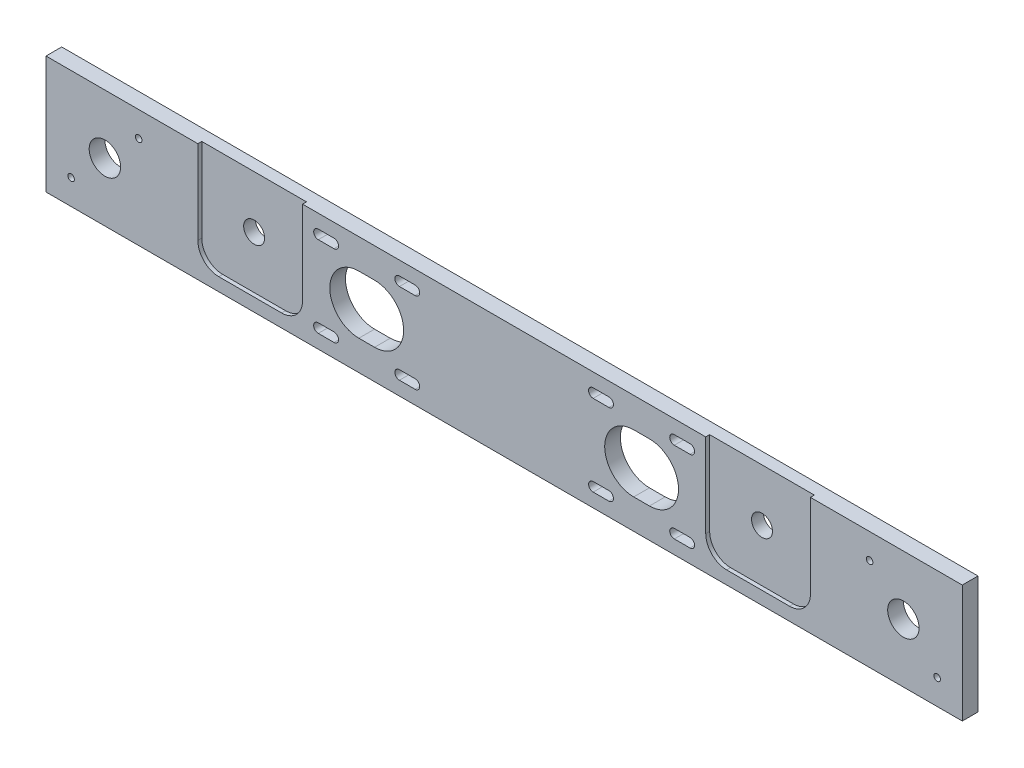
from build123d import *

# Parameters (mm, degrees)
CROQUIS1_W              = 350
CROQUIS1_H              = 45
SALIENTE_EXTRUIR1_DEPTH = 6
CROQUIS2_R              = 6
CROQUIS2_R_2            = 1.25
CORTAR_EXTRUIR1_DEPTH   = 353.932004783
CORTAR_EXTRUIR2_DEPTH   = 353.932004783
CORTAR_EXTRUIR4_DEPTH   = 1.5
CROQUIS7_R              = 4
CORTAR_EXTRUIR5_DEPTH   = 353.909690998


with BuildPart() as part:
    # Croquis1 → Saliente-Extruir1 (new body)
    with BuildSketch(Plane.XY):
        with Locations((-175, -22.5)):
            Rectangle(CROQUIS1_W, CROQUIS1_H)
    extrude(amount=SALIENTE_EXTRUIR1_DEPTH)

    # Croquis2 → Cortar-Extruir1 (cut, through all)
    with BuildSketch(Plane.XY.offset(6)):
        with Locations((-327.5, -22.5)):
            Circle(CROQUIS2_R)
        with Locations((-22.5, -22.5)):
            Circle(CROQUIS2_R)
        with Locations((-314.595301243, -9.595301243)):
            Circle(CROQUIS2_R_2)
        with Locations((-340.404698757, -35.404698757)):
            Circle(CROQUIS2_R_2)
        with Locations((-35.404698757, -9.595301243)):
            Circle(CROQUIS2_R_2)
        with Locations((-9.595301243, -35.404698757)):
            Circle(CROQUIS2_R_2)
    extrude(amount=-CORTAR_EXTRUIR1_DEPTH, mode=Mode.SUBTRACT)

    # Croquis3 → Cortar-Extruir2 (cut, through all)
    with BuildSketch(Plane.XY.offset(6)):
        with BuildLine():
            Line((-141, -5.25), (-135, -5.25))
            ThreePointArc((-135, -5.25), (-133.25, -7), (-135, -8.75))
            Line((-135, -8.75), (-141, -8.75))
            ThreePointArc((-141, -8.75), (-142.75, -7), (-141, -5.25))
        make_face()
        with BuildLine():
            Line((-125.5, -11.4), (-119.5, -11.4))
            ThreePointArc((-119.5, -11.4), (-108.4, -22.5), (-119.5, -33.6))
            Line((-119.5, -33.6), (-125.5, -33.6))
            ThreePointArc((-125.5, -33.6), (-136.6, -22.5), (-125.5, -11.4))
        make_face()
        with BuildLine():
            Line((-141, -36.25), (-135, -36.25))
            ThreePointArc((-135, -36.25), (-133.25, -38), (-135, -39.75))
            Line((-135, -39.75), (-141, -39.75))
            ThreePointArc((-141, -39.75), (-142.75, -38), (-141, -36.25))
        make_face()
        with BuildLine():
            Line((-110, -5.25), (-104, -5.25))
            ThreePointArc((-104, -5.25), (-102.25, -7), (-104, -8.75))
            Line((-104, -8.75), (-110, -8.75))
            ThreePointArc((-110, -8.75), (-111.75, -7), (-110, -5.25))
        make_face()
        with BuildLine():
            Line((-110, -36.25), (-104, -36.25))
            ThreePointArc((-104, -36.25), (-102.25, -38), (-104, -39.75))
            Line((-104, -39.75), (-110, -39.75))
            ThreePointArc((-110, -39.75), (-111.75, -38), (-110, -36.25))
        make_face()
        with BuildLine():
            Line((-246, -5.25), (-240, -5.25))
            ThreePointArc((-240, -5.25), (-238.25, -7), (-240, -8.75))
            Line((-240, -8.75), (-246, -8.75))
            ThreePointArc((-246, -8.75), (-247.75, -7), (-246, -5.25))
        make_face()
        with BuildLine():
            Line((-230.5, -11.4), (-224.5, -11.4))
            ThreePointArc((-224.5, -11.4), (-213.4, -22.5), (-224.5, -33.6))
            Line((-224.5, -33.6), (-230.5, -33.6))
            ThreePointArc((-230.5, -33.6), (-241.6, -22.5), (-230.5, -11.4))
        make_face()
        with BuildLine():
            Line((-246, -36.25), (-240, -36.25))
            ThreePointArc((-240, -36.25), (-238.25, -38), (-240, -39.75))
            Line((-240, -39.75), (-246, -39.75))
            ThreePointArc((-246, -39.75), (-247.75, -38), (-246, -36.25))
        make_face()
        with BuildLine():
            Line((-215, -5.25), (-209, -5.25))
            ThreePointArc((-209, -5.25), (-207.25, -7), (-209, -8.75))
            Line((-209, -8.75), (-215, -8.75))
            ThreePointArc((-215, -8.75), (-216.75, -7), (-215, -5.25))
        make_face()
        with BuildLine():
            Line((-215, -36.25), (-209, -36.25))
            ThreePointArc((-209, -36.25), (-207.25, -38), (-209, -39.75))
            Line((-209, -39.75), (-215, -39.75))
            ThreePointArc((-215, -39.75), (-216.75, -38), (-215, -36.25))
        make_face()
    extrude(amount=-CORTAR_EXTRUIR2_DEPTH, mode=Mode.SUBTRACT)

    # Croquis5 → Cortar-Extruir4 (cut)
    with BuildSketch(Plane.XY.offset(6)):
        with BuildLine():
            Line((-292, 0), (-252, 0))
            Line((-252, 0), (-252, -32))
            ThreePointArc((-252, -32), (-254.343145751, -37.656854249), (-260, -40))
            Line((-260, -40), (-284, -40))
            ThreePointArc((-284, -40), (-289.656854249, -37.656854249), (-292, -32))
            Line((-292, -32), (-292, 0))
        make_face()
        with BuildLine():
            Line((-98, 0), (-58, 0))
            Line((-58, 0), (-58, -32))
            ThreePointArc((-58, -32), (-60.343145751, -37.656854249), (-66, -40))
            Line((-66, -40), (-90, -40))
            ThreePointArc((-90, -40), (-95.656854249, -37.656854249), (-98, -32))
            Line((-98, -32), (-98, 0))
        make_face()
    extrude(amount=-CORTAR_EXTRUIR4_DEPTH, mode=Mode.SUBTRACT)

    # Croquis7 → Cortar-Extruir5 (cut, through all)
    with BuildSketch(Plane.XY.offset(4.5)):
        with Locations((-272, -20)):
            Circle(CROQUIS7_R)
        with Locations((-78, -20)):
            Circle(CROQUIS7_R)
    extrude(amount=-CORTAR_EXTRUIR5_DEPTH, mode=Mode.SUBTRACT)


solid = part.part
